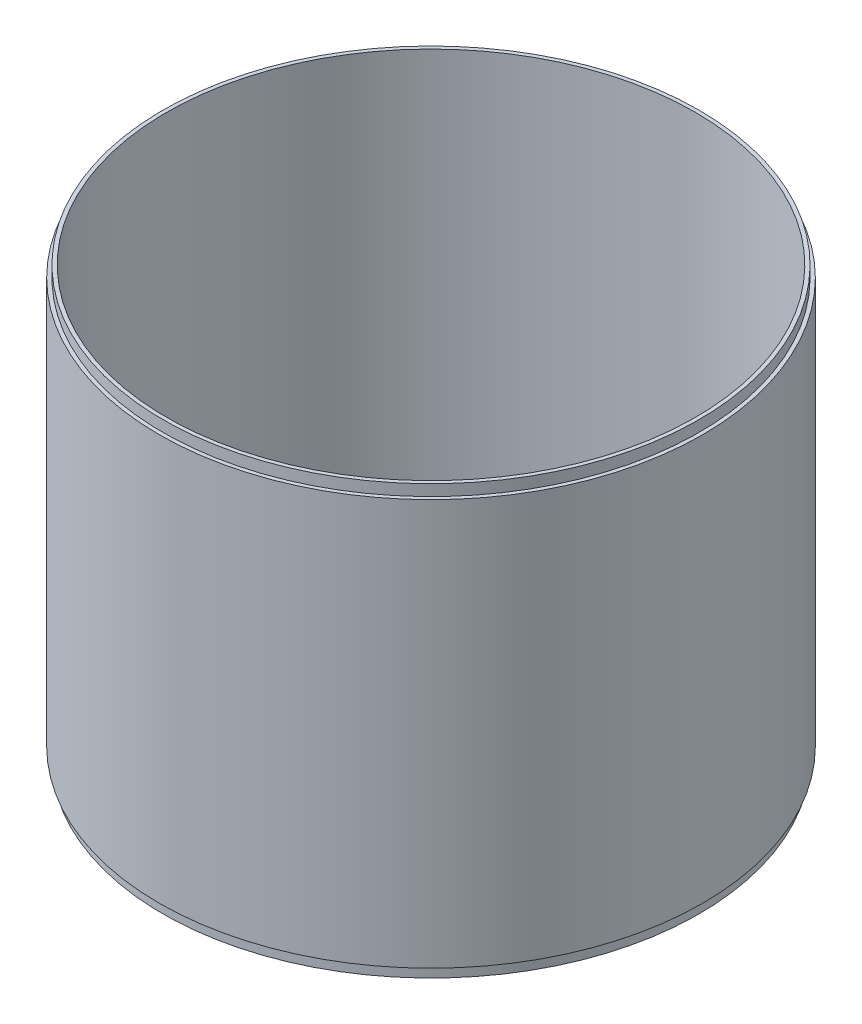
from build123d import *


with BuildPart() as part:
    # Schizzo1 → Rivoluzione1 (revolve)
    with BuildSketch(Plane.XY):
        Polygon((-71, 0), (-71, 3), (-71, 115), (-72, 115), (-72, 112), (-73, 112), (-73, 3), (-72, 3), (-72, 0), align=None)
    revolve(axis=Axis((0, 0, 0), (0, 1, 0)))


solid = part.part
